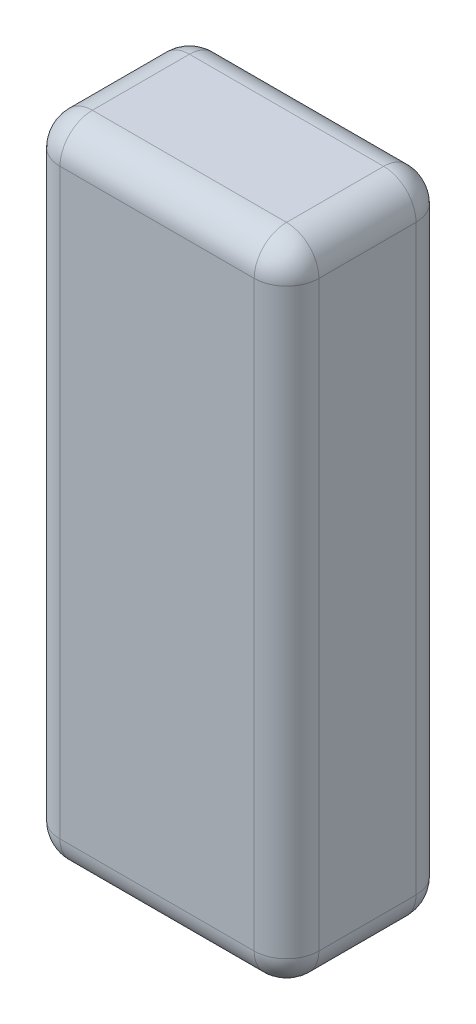
from build123d import *

# Parameters (mm, degrees)
BOSS_EXTRUDE1_DEPTH = 50
FILLET1_R           = 10
SHELL3_T            = 5


with BuildPart() as part:
    # Sketch1 → Boss-Extrude1 (new body)
    with BuildSketch(Plane.XY):
        with BuildLine():
            Line((10, 0), (70, 0))
            ThreePointArc((70, 0), (77.071067812, 2.928932188), (80, 10))
            Line((80, 10), (80, 190))
            ThreePointArc((80, 190), (77.071067812, 197.071067812), (70, 200))
            Line((70, 200), (10, 200))
            ThreePointArc((10, 200), (2.928932188, 197.071067812), (0, 190))
            Line((0, 190), (0, 10))
            ThreePointArc((0, 10), (2.928932188, 2.928932188), (10, 0))
        make_face()
    extrude(amount=BOSS_EXTRUDE1_DEPTH)

    # Fillet1
    fillet1_edges = [part.edges().sort_by_distance(p)[0] for p in [
        (77.071067812, 2.928932188, 50),
        (40, 0, 50),
        (2.928932188, 2.928932188, 50),
        (0, 100, 50),
        (2.928932188, 197.071067812, 50),
        (40, 200, 50),
        (77.071067812, 197.071067812, 50),
        (77.071067812, 2.928932188, 0),
        (40, 0, 0),
        (2.928932188, 2.928932188, 0),
        (0, 100, 0),
        (2.928932188, 197.071067812, 0),
        (40, 200, 0),
        (77.071067812, 197.071067812, 0),
        (80, 100, 50),
        (80, 100, 0),
    ]]
    fillet(fillet1_edges, radius=FILLET1_R)

    # Shell3 (no face opened: a closed hollow body)
    add(offset(amount=-SHELL3_T, mode=Mode.PRIVATE), mode=Mode.SUBTRACT)


solid = part.part
